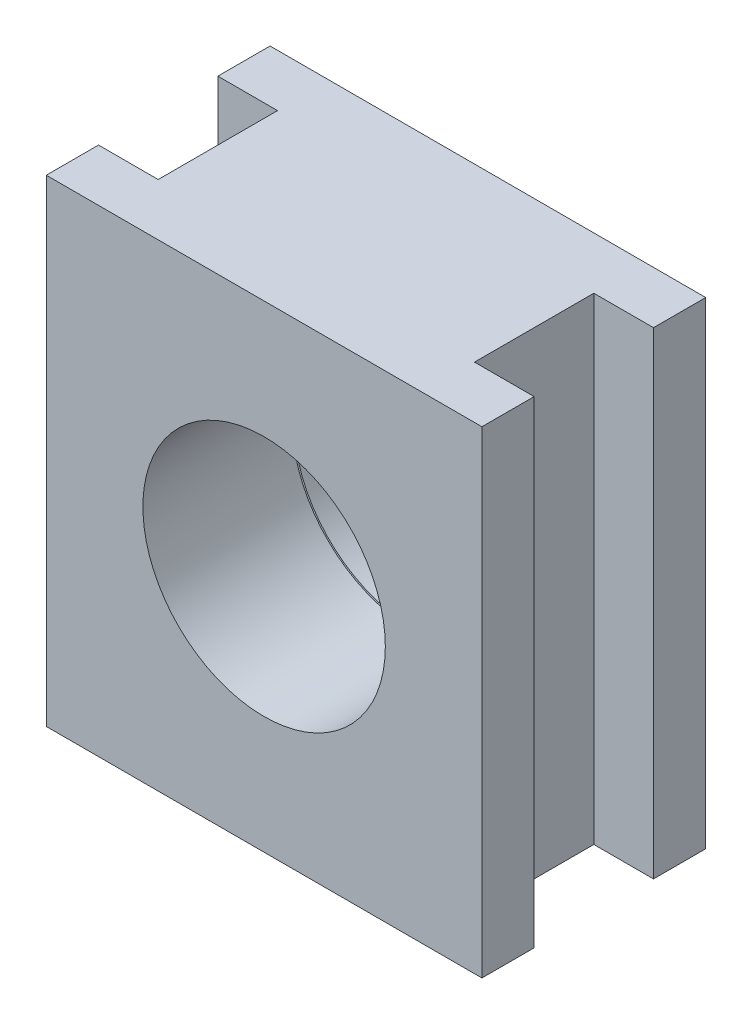
from build123d import *

# Parameters (mm, degrees)
SKETCH1_W           = 26.924
SKETCH1_H           = 40.64
BOSS_EXTRUDE1_DEPTH = 19.05
SKETCH2_W           = 4.445
SKETCH2_H           = 40.64
BOSS_EXTRUDE2_DEPTH = 5.08
SKETCH3_R           = 10.31875
CUT_EXTRUDE1_DEPTH  = 12.7
SKETCH4_R           = 10.16
CUT_EXTRUDE2_DEPTH  = 3.175


with BuildPart() as part:
    # Sketch1 → Boss-Extrude1 (new body)
    with BuildSketch(Plane.XY):
        Rectangle(SKETCH1_W, SKETCH1_H)
    extrude(amount=BOSS_EXTRUDE1_DEPTH)

    # Sketch2 → Boss-Extrude2 (add)
    with BuildSketch(Plane(origin=(13.462, 0, 0), x_dir=(0, 0, -1), z_dir=(1, 0, 0))):
        with Locations((-16.8275, 0)):
            Rectangle(SKETCH2_W, SKETCH2_H)
        with Locations((-2.2225, 0)):
            Rectangle(SKETCH2_W, SKETCH2_H)
    boss_extrude2 = extrude(amount=BOSS_EXTRUDE2_DEPTH)

    # Mirror1: Boss-Extrude2 across plane
    add(boss_extrude2.mirror(Plane(origin=(0, 0, 0), x_dir=(0, 0, 1), z_dir=(1, 0, 0))))

    # Sketch3 → Cut-Extrude1 (cut)
    with BuildSketch(Plane.XY.offset(19.05)):
        Circle(SKETCH3_R)
    extrude(amount=-CUT_EXTRUDE1_DEPTH, mode=Mode.SUBTRACT)

    # Sketch4 → Cut-Extrude2 (cut)
    with BuildSketch(Plane.XY.offset(6.35)):
        Circle(SKETCH4_R)
    extrude(amount=-CUT_EXTRUDE2_DEPTH, mode=Mode.SUBTRACT)


solid = part.part
